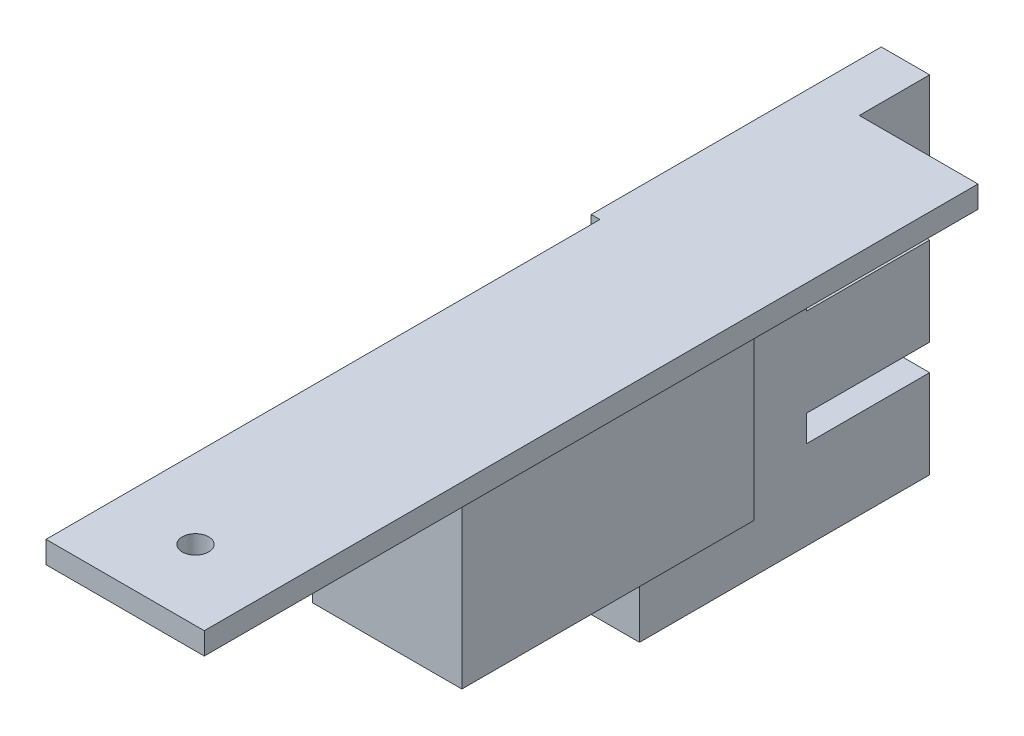
from build123d import *

# Parameters (mm, degrees)
S_BOX1_W       = 18
S_BOX1_H       = 2.5
BOSS_1_DEPTH   = 88
S_BOX2_W       = 17
S_BOX2_H       = 18.4
BOSS_2_DEPTH   = 33.2
S_BOX3_W       = 5.5
S_BOX3_H       = 39.4
BOSS_3_DEPTH   = 33
S_CUT4_W       = 13
S_CUT4_H       = 18.5
POCKET_4_DEPTH = 23.6
S_HOLE5_R      = 1.5
HOLE_5_DEPTH   = 2.7
S_HOLE6_R      = 0.8
HOLE_6_DEPTH   = 6.1
S_HOLE7_R      = 0.8
HOLE_7_DEPTH   = 6.1
S_CUT8_W       = 5.7
S_CUT8_H       = 3
POCKET_8_DEPTH = 14.1
S_CUT9_W       = 5.7
S_CUT9_H       = 3
POCKET_9_DEPTH = 14.1


with BuildPart() as part:
    # S_box1 → Boss_1 (new body)
    with BuildSketch(Plane.XY.offset(-80)):
        with Locations((0, 19.45)):
            Rectangle(S_BOX1_W, S_BOX1_H)
    extrude(amount=BOSS_1_DEPTH)

    # S_box2 → Boss_2 (add)
    with BuildSketch(Plane.XY.offset(-55)):
        with Locations((0, 9)):
            Rectangle(S_BOX2_W, S_BOX2_H)
    extrude(amount=BOSS_2_DEPTH)

    # S_box3 → Boss_3 (add)
    with BuildSketch(Plane.XY.offset(-88)):
        with Locations((-7.25, 1)):
            Rectangle(S_BOX3_W, S_BOX3_H)
    extrude(amount=BOSS_3_DEPTH)

    # S_cut4 → Pocket_4 (cut)
    with BuildSketch(Plane.XY.offset(-50.2)):
        with Locations((0, 8.95)):
            Rectangle(S_CUT4_W, S_CUT4_H)
    extrude(amount=POCKET_4_DEPTH, mode=Mode.SUBTRACT)

    # S_hole5 → Hole_5 (cut)
    with BuildSketch(Plane(origin=(0, 18.1, 0), x_dir=(1, 0, 0), z_dir=(0, 1, 0))):
        Circle(S_HOLE5_R)
    extrude(amount=HOLE_5_DEPTH, mode=Mode.SUBTRACT)

    # S_hole6 → Hole_6 (cut)
    with BuildSketch(Plane(origin=(0, -0.3, 0), x_dir=(1, 0, 0), z_dir=(0, 1, 0))):
        with Locations((0, 52.4)):
            Circle(S_HOLE6_R)
    extrude(amount=HOLE_6_DEPTH, mode=Mode.SUBTRACT)

    # S_hole7 → Hole_7 (cut)
    with BuildSketch(Plane(origin=(0, -0.3, 0), x_dir=(1, 0, 0), z_dir=(0, 1, 0))):
        with Locations((0, 24.4)):
            Circle(S_HOLE7_R)
    extrude(amount=HOLE_7_DEPTH, mode=Mode.SUBTRACT)

    # S_cut8 → Pocket_8 (cut)
    with BuildSketch(Plane.XY.offset(-88.1)):
        with Locations((-7.25, -7.13)):
            Rectangle(S_CUT8_W, S_CUT8_H)
    extrude(amount=POCKET_8_DEPTH, mode=Mode.SUBTRACT)

    # S_cut9 → Pocket_9 (cut)
    with BuildSketch(Plane.XY.offset(-88.1)):
        with Locations((-7.25, 5.93)):
            Rectangle(S_CUT9_W, S_CUT9_H)
    extrude(amount=POCKET_9_DEPTH, mode=Mode.SUBTRACT)


solid = part.part
